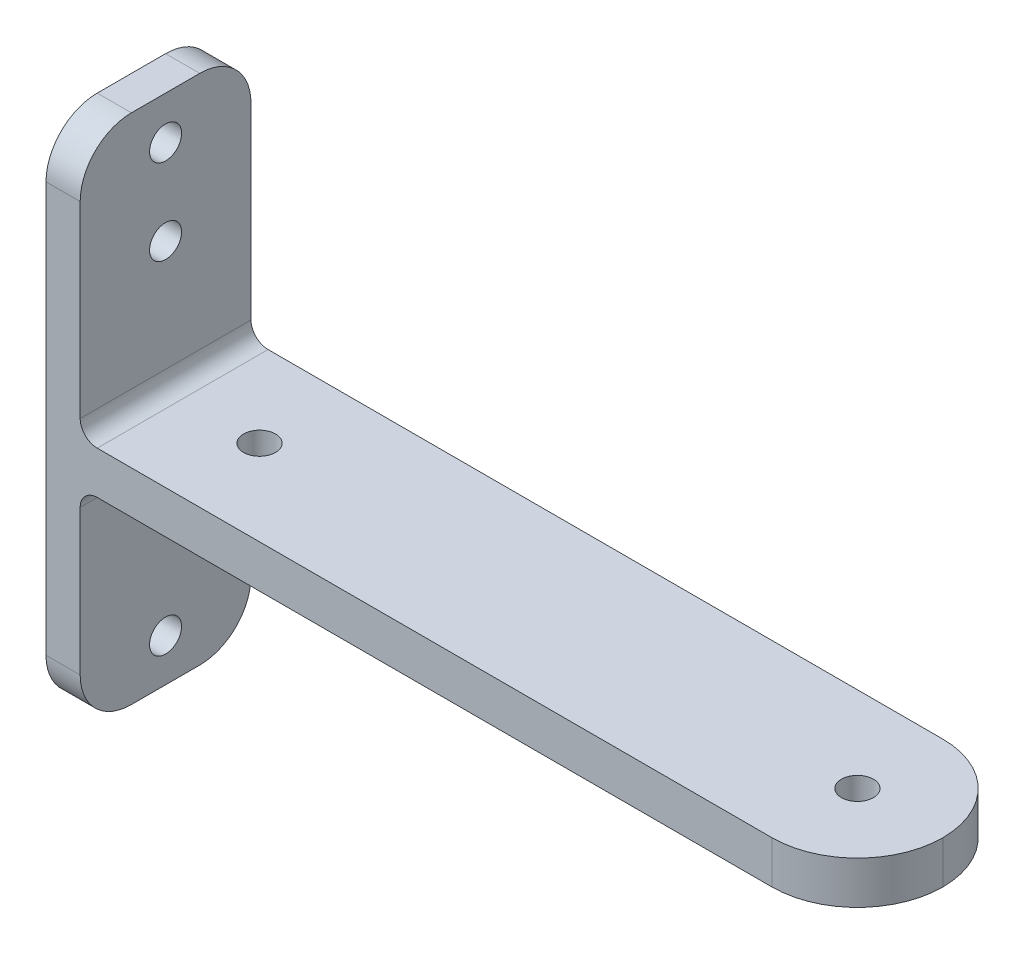
from build123d import *

# Parameters (mm, degrees)
SKETCH1_W                = 120.65
SKETCH1_H                = 25.4
SKETCH1_R                = 2.38125
BOSS_EXTRUDE1_DEPTH      = 6.35
SKETCH2_R                = 2.38125
CUT_EXTRUDE1_DEPTH       = 6.35
BOSS_EXTRUDE2_DEPTH      = 38.1
BOSS_EXTRUDE2_DEPTH_BACK = 38.1
SKETCH3_W                = 5.08
SKETCH3_H                = 25.4
SKETCH4_R                = 2.38125
CUT_EXTRUDE2_DEPTH       = 130.203386179
FILLET1_R                = 2.54
FILLET2_R                = 7.62
FILLET3_R                = 12.7


with BuildPart() as part:
    # Sketch1 → Boss-Extrude1 (new body)
    with BuildSketch(Plane(origin=(0, 0, 0), x_dir=(1, 0, 0), z_dir=(0, 1, 0))):
        Rectangle(SKETCH1_W, SKETCH1_H)
        with Locations(Location((47.625, 0, 0), (0, 0, 270))):
            Circle(SKETCH1_R, mode=Mode.SUBTRACT)
    extrude(amount=BOSS_EXTRUDE1_DEPTH)

    # Sketch2 → Cut-Extrude1 (cut)
    with BuildSketch(Plane(origin=(0, 6.35, 0), x_dir=(1, 0, 0), z_dir=(0, 1, 0))):
        with Locations(Location((-41.275, 0, 0), (0, 0, 270))):
            Circle(SKETCH2_R)
    extrude(amount=-CUT_EXTRUDE1_DEPTH, mode=Mode.SUBTRACT)

    # Sketch3 → Boss-Extrude2 (add, two sides: drawn at the far end of the back side and taken through both)
    with BuildSketch(Plane(origin=(0, 6.35, 0), x_dir=(1, 0, 0), z_dir=(0, 1, 0)).offset(-BOSS_EXTRUDE2_DEPTH_BACK)):
        with Locations((-57.785, 0)):
            Rectangle(SKETCH3_W, SKETCH3_H)
    extrude(amount=BOSS_EXTRUDE2_DEPTH + BOSS_EXTRUDE2_DEPTH_BACK)

    # Sketch4 → Cut-Extrude2 (cut, through all)
    with BuildSketch(Plane.ZY.offset(60.325)):
        with Locations((0, 25.4)):
            Circle(SKETCH4_R)
        with Locations((0, -25.4)):
            Circle(SKETCH4_R)
        with Locations((0, 38.1)):
            Circle(SKETCH4_R)
    extrude(amount=-CUT_EXTRUDE2_DEPTH, mode=Mode.SUBTRACT)

    # Fillet1
    fillet1_edges = [part.edges().sort_by_distance(p)[0] for p in [
        (-55.245, 0, 0),
        (-55.245, 6.35, 0),
    ]]
    fillet(fillet1_edges, radius=FILLET1_R)

    # Fillet2
    fillet2_edges = [part.edges().sort_by_distance(p)[0] for p in [
        (-57.785, -31.75, -12.7),
        (-57.785, -31.75, 12.7),
        (-57.785, 44.45, 12.7),
        (-57.785, 44.45, -12.7),
    ]]
    fillet(fillet2_edges, radius=FILLET2_R)

    # Fillet3
    fillet3_edges = [part.edges().sort_by_distance(p)[0] for p in [
        (60.325, 3.175, 12.7),
        (60.325, 3.175, -12.7),
    ]]
    fillet(fillet3_edges, radius=FILLET3_R - 0.0001)  # a hair under: the kernel refuses the full size


solid = part.part
